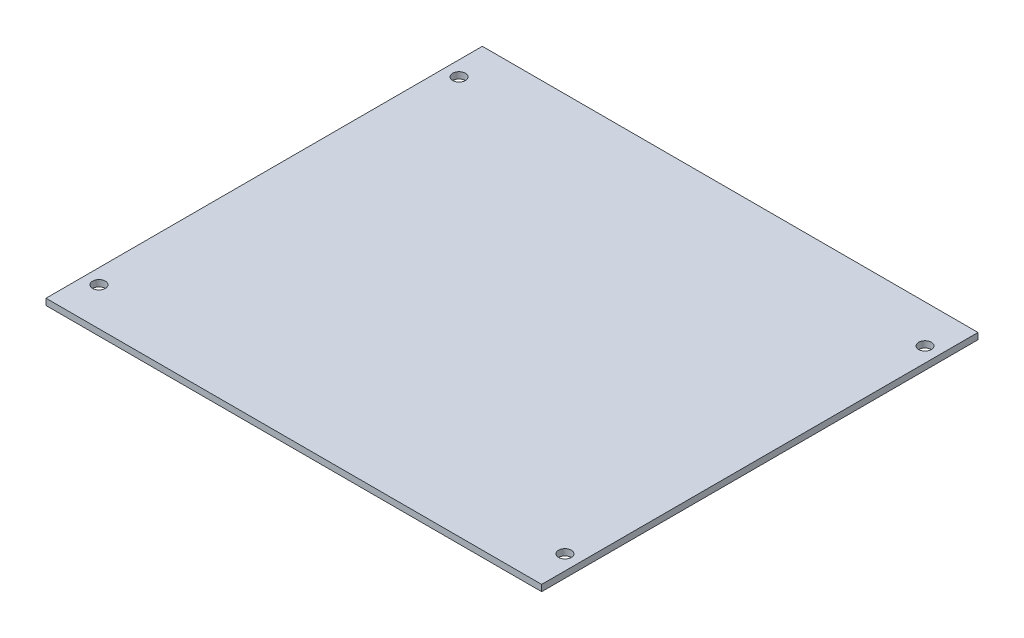
from build123d import *

# Parameters (mm, degrees)
SKETCH_1_W      = 117
SKETCH_1_H      = 103
SKETCH_1_R      = 1.5
EXTRUDE_1_DEPTH = 1.5


with BuildPart() as part:
    # Эскиз1 → Бобышка-Вытянуть1 (new body)
    with BuildSketch(Plane(origin=(0, 0, 0), x_dir=(1, 0, 0), z_dir=(0, 1, 0))):
        Rectangle(SKETCH_1_W, SKETCH_1_H)
        with Locations((-55, 42.5)):
            Circle(SKETCH_1_R, mode=Mode.SUBTRACT)
        with Locations((55, 42.5)):
            Circle(SKETCH_1_R, mode=Mode.SUBTRACT)
        with Locations((55, -42.5)):
            Circle(SKETCH_1_R, mode=Mode.SUBTRACT)
        with Locations((-55, -42.5)):
            Circle(SKETCH_1_R, mode=Mode.SUBTRACT)
    extrude(amount=EXTRUDE_1_DEPTH)


solid = part.part
